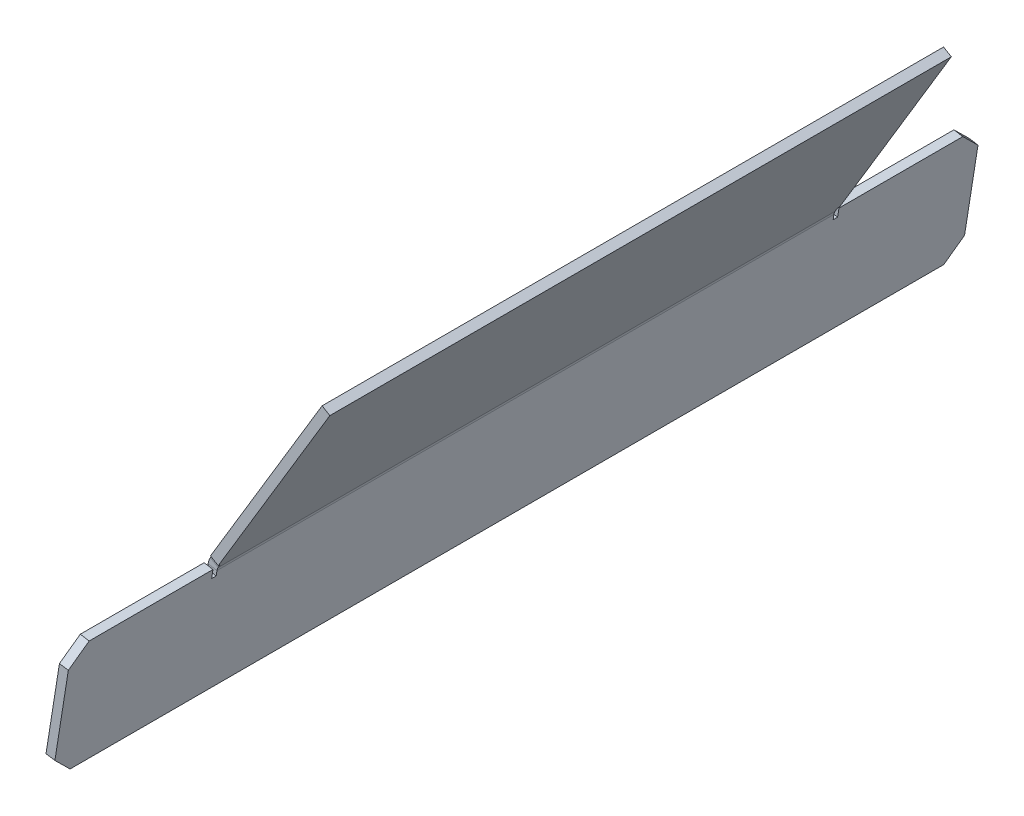
from build123d import *

# Parameters (mm, degrees)
BOSS_EXTRUDE1_DEPTH      = 109.5375
BOSS_EXTRUDE1_DEPTH_BACK = 109.5375
SKETCH2_W                = 50.8
SKETCH2_H                = 42.97785953
BOSS_EXTRUDE2_DEPTH      = 3.175
CHAMFER1_SIZE            = 6.35
CONVERT_SOLID1_START     = -110.33125
CONVERT_SOLID1_DEPTH     = 220.6625
CONVERT_SOLID1_2_DEPTH   = 1.5875
CONVERT_SOLID1_START_2   = 108.74375
CONVERT_SOLID1_3_DEPTH   = 1.5875
CONVERT_SOLID1_START_3   = -108.74375
CONVERT_SOLID1_4_DEPTH   = 217.4875


# Read off the part's stored shape, not the designer's step: Convert-Solid1
with BuildPart() as part:
    # Sketch1 → Boss-Extrude1 (new, two sides: drawn at the far end of the back side and taken through both)
    with BuildSketch(Plane.XY.offset(-BOSS_EXTRUDE1_DEPTH_BACK)):
        Polygon((640.29736406, 709.2417051), (646.924037824, 751.080876614), (687.413907929, 818.467336674), (684.69240175, 820.102582562), (643.884672043, 752.187115289), (637.161453578, 709.738384527), align=None)
    extrude(amount=BOSS_EXTRUDE1_DEPTH + BOSS_EXTRUDE1_DEPTH_BACK)

    # Sketch2 → Boss-Extrude2 (add)
    with BuildSketch(Plane(origin=(511.908391779, -81.078324129, 0), x_dir=(0, 0, 1), z_dir=(-0.9876883405951397, 0.1564344650402187, 0))):
        with Locations((-134.9375, 822.16326817)):
            Rectangle(SKETCH2_W, SKETCH2_H)
        with Locations((134.9375, 822.16326817)):
            Rectangle(SKETCH2_W, SKETCH2_H)
    extrude(amount=-BOSS_EXTRUDE2_DEPTH)

    # Chamfer1
    chamfer1_edges = [part.edges().sort_by_distance(p)[0] for p in [
        (645.452627283, 751.938775576, -160.3375),
        (638.729408819, 709.490044814, -160.3375),
        (645.452627283, 751.938775576, 160.3375),
        (638.729408819, 709.490044814, 160.3375),
    ]]
    chamfer(chamfer1_edges, length=CHAMFER1_SIZE)

    # Convert-Solid1 outline → Convert-Solid1 (cut)
    with BuildSketch(Plane.XY.offset(CONVERT_SOLID1_START)):
        with BuildLine():
            Line((644.520391245, 753.245129714), (643.884672043, 752.187115289))
            Line((643.884672043, 752.187115289), (643.691582642, 750.967996791))
            ThreePointArc((643.691582642, 750.967996791), (643.996355462, 752.146465849), (644.520391245, 753.245129714))
        make_face()
    extrude(amount=CONVERT_SOLID1_DEPTH, mode=Mode.SUBTRACT)

    # Convert-Solid1 2 outline → Convert-Solid1 2 (cut)
    with BuildSketch(Plane.XY.offset(CONVERT_SOLID1_START)):
        with BuildLine():
            Line((647.241897425, 751.609883826), (648.059520369, 752.970636916))
            Line((648.059520369, 752.970636916), (645.338014189, 754.605882804))
            Line((645.338014189, 754.605882804), (644.520391245, 753.245129714))
            ThreePointArc((644.520391245, 753.245129714), (643.996355462, 752.146465849), (643.691582642, 750.967996791))
            Line((643.691582642, 750.967996791), (643.408575407, 749.181159432))
            Line((643.408575407, 749.181159432), (646.544485888, 748.684480005))
            Line((646.544485888, 748.684480005), (646.924037824, 751.080876614))
            Line((646.924037824, 751.080876614), (647.241897425, 751.609883826))
        make_face()
    extrude(amount=CONVERT_SOLID1_2_DEPTH, mode=Mode.SUBTRACT)

    # Convert-Solid1 3 outline → Convert-Solid1 3 (cut)
    with BuildSketch(Plane.XY.offset(CONVERT_SOLID1_START_2)):
        with BuildLine():
            Line((647.241897425, 751.609883826), (648.059520369, 752.970636916))
            Line((648.059520369, 752.970636916), (645.338014189, 754.605882804))
            Line((645.338014189, 754.605882804), (644.520391245, 753.245129714))
            ThreePointArc((644.520391245, 753.245129714), (643.996355462, 752.146465849), (643.691582642, 750.967996791))
            Line((643.691582642, 750.967996791), (643.408575407, 749.181159432))
            Line((643.408575407, 749.181159432), (646.544485888, 748.684480005))
            Line((646.544485888, 748.684480005), (646.924037824, 751.080876614))
            Line((646.924037824, 751.080876614), (647.241897425, 751.609883826))
        make_face()
    extrude(amount=CONVERT_SOLID1_3_DEPTH, mode=Mode.SUBTRACT)

    # Convert-Solid1 4 outline → Convert-Solid1 4 (add)
    with BuildSketch(Plane.XY.offset(CONVERT_SOLID1_START_3)):
        with BuildLine():
            ThreePointArc((646.827493123, 750.471317365), (646.979879533, 751.060551894), (647.241897425, 751.609883826))
            Line((647.241897425, 751.609883826), (646.924037824, 751.080876614))
            Line((646.924037824, 751.080876614), (646.827493123, 750.471317365))
        make_face()
    extrude(amount=CONVERT_SOLID1_4_DEPTH)


solid = part.part
